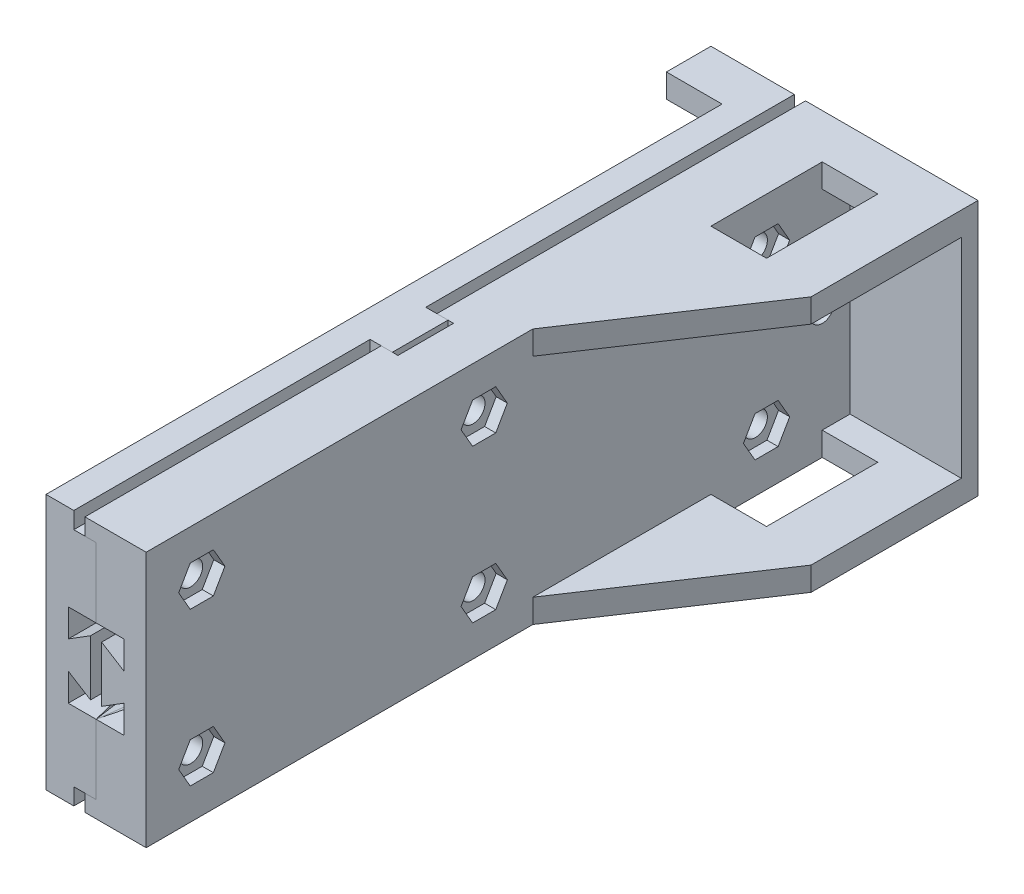
from build123d import *

# Parameters (mm, degrees)
SKETCH1_W                = 116.5
SKETCH1_H                = 15
BOSS_EXTRUDE1_DEPTH      = 1
SKETCH2_W                = 20
SKETCH2_H                = 15
BOSS_EXTRUDE2_DEPTH      = 4
CUT_EXTRUDE1_DEPTH       = 97.920070161
MIRROR2_COPY_1_SKETCH_W  = 20
MIRROR2_COPY_1_SKETCH_H  = 15
MIRROR2_COPY_1_DEPTH     = 4
MIRROR2_COPY_2_DEPTH     = 97.920070161
BOSS_EXTRUDE5_DEPTH      = 2.5
CUT_EXTRUDE2_DEPTH       = 60.942159621
SKETCH9_R                = 0.75
CUT_EXTRUDE3_DEPTH       = 118.0352511
CUT_EXTRUDE4_DEPTH       = 118.0352511
BOSS_EXTRUDE6_DEPTH      = 4
BOSS_EXTRUDE6_DEPTH_BACK = 14
SKETCH11_W               = 126.5
SKETCH11_H               = 40
BOSS_EXTRUDE7_START      = -11
BOSS_EXTRUDE7_DEPTH      = 11
BOSS_EXTRUDE8_DEPTH      = 5
SKETCH14_W               = 10
SKETCH14_H               = 3
BOSS_EXTRUDE9_DEPTH      = 4
SKETCH15_W               = 10
SKETCH15_H               = 3
CUT_EXTRUDE5_DEPTH       = 3
SKETCH16_R               = 2.15
CUT_EXTRUDE6_DEPTH       = 78.003652511
SKETCH18_R               = 1
CUT_EXTRUDE7_DEPTH       = 76.535173926
SKETCH19_R               = 3.5
SKETCH19_R_2             = 1
CUT_EXTRUDE8_DEPTH       = 2
SKETCH20_R               = 5.5
SKETCH20_R_2             = 3.5
BOSS_EXTRUDE10_DEPTH     = 2
BOSS_EXTRUDE11_DEPTH     = 20
CUT_EXTRUDE9_DEPTH       = 90.630142809
SKETCH24_W               = 20
SKETCH24_H               = 46
CUT_EXTRUDE10_DEPTH      = 10
CUT_EXTRUDE11_DEPTH      = 2
SKETCH26_W               = 8
SKETCH26_H               = 4.25
BOSS_EXTRUDE12_DEPTH     = 10


# Read off the part's stored shape, not the designer's step: Boss-Extrude7
with BuildPart() as part:
    # Sketch1 → Boss-Extrude1 (new, symmetric)
    with BuildSketch(Plane(origin=(0, 0, 0), x_dir=(0, 0, -1), z_dir=(1, 0, 0))):
        Rectangle(SKETCH1_W, SKETCH1_H)
    extrude(amount=BOSS_EXTRUDE1_DEPTH, both=True)

    # Sketch2 → Boss-Extrude2 (add)
    with BuildSketch(Plane(origin=(1, 0, 0), x_dir=(0, 0, -1), z_dir=(1, 0, 0))):
        with Locations((48.25, 0)):
            Rectangle(SKETCH2_W, SKETCH2_H)
    boss_extrude2 = extrude(amount=BOSS_EXTRUDE2_DEPTH)

    # Sketch3 → Cut-Extrude1 (cut, through all)
    with BuildSketch(Plane.XY.offset(-38.25)):
        Polygon((5, 2.5), (1, 5), (1, -5), (5, -2.5), align=None)
    cut_extrude1 = extrude(amount=-CUT_EXTRUDE1_DEPTH, mode=Mode.SUBTRACT)

    # Mirror1: Boss-Extrude2, Cut-Extrude1 across plane
    add(boss_extrude2.mirror(Plane(origin=(0, 0, 0), x_dir=(0, 0, 1), z_dir=(1, 0, 0))))
    add(cut_extrude1.mirror(Plane(origin=(0, 0, 0), x_dir=(0, 0, 1), z_dir=(1, 0, 0))), mode=Mode.SUBTRACT)

    # Mirror2: Boss-Extrude2, Cut-Extrude1 across plane
    add(boss_extrude2.mirror(Plane.XY))
    add(cut_extrude1.mirror(Plane.XY), mode=Mode.SUBTRACT)

    # Mirror2 copy 1 sketch → Mirror2 copy 1 (add)
    with BuildSketch(Plane.ZY.offset(1)):
        with Locations((48.25, 0)):
            Rectangle(MIRROR2_COPY_1_SKETCH_W, MIRROR2_COPY_1_SKETCH_H)
    extrude(amount=MIRROR2_COPY_1_DEPTH)

    # Mirror2 copy 2 sketch → Mirror2 copy 2 (cut, through all)
    with BuildSketch(Plane(origin=(0, 0, 38.25), x_dir=(-1, 0, 0), z_dir=(0, 0, -1))):
        Polygon((5, 2.5), (1, 5), (1, -5), (5, -2.5), align=None)
    extrude(amount=-MIRROR2_COPY_2_DEPTH, mode=Mode.SUBTRACT)

    # Sketch7 → Boss-Extrude5 (add)
    with BuildSketch(Plane(origin=(0, 7.5, 0), x_dir=(1, 0, 0), z_dir=(0, 1, 0))):
        Polygon((0, -58.25), (-5, -38.25), (-5, 38.25), (0, 58.25), (5, 38.25), (5, -38.25), align=None)
    boss_extrude5 = extrude(amount=BOSS_EXTRUDE5_DEPTH)

    # Sketch8 → Cut-Extrude2 (cut, through all)
    with BuildSketch(Plane.ZY.offset(5)):
        Polygon((-38.25, 10), (-58.25, 7.5), (-58.25, 10), align=None)
        Polygon((58.25, 10), (38.25, 10), (58.25, 7.5), align=None)
    cut_extrude2 = extrude(amount=-CUT_EXTRUDE2_DEPTH, mode=Mode.SUBTRACT)

    # Sketch9 → Cut-Extrude3 (cut, through all)
    with BuildSketch(Plane.XY.offset(58.25)):
        with Locations((1.2, 9.7)):
            Circle(SKETCH9_R)
        with Locations((-1.2, 9.7)):
            Circle(SKETCH9_R)
    cut_extrude3 = extrude(amount=-CUT_EXTRUDE3_DEPTH, mode=Mode.SUBTRACT)

    # Mirror4: Boss-Extrude5, Cut-Extrude2, Cut-Extrude3 across plane
    add(boss_extrude5.mirror(Plane.ZX))
    add(cut_extrude2.mirror(Plane.ZX), mode=Mode.SUBTRACT)
    add(cut_extrude3.mirror(Plane.ZX), mode=Mode.SUBTRACT)

    # Sketch10 → Cut-Extrude4 (cut, through all)
    with BuildSketch(Plane(origin=(0, 0, -58.25), x_dir=(-1, 0, 0), z_dir=(0, 0, -1))):
        Polygon((-5, 8.5), (-3.2, 10), (-5, 10), align=None)
        Polygon((5, 10), (5, 8.5), (3.2, 10), align=None)
        Polygon((-5, -10), (-5, -8.5), (-3.2, -10), align=None)
        Polygon((5, -8.5), (3.2, -10), (5, -10), align=None)
    extrude(amount=-CUT_EXTRUDE4_DEPTH, mode=Mode.SUBTRACT)


with BuildPart() as body_2:
    # Sketch11 → Boss-Extrude6 (new, two sides: drawn at the far end of the back side and taken through both)
    with BuildSketch(Plane.ZY.offset(5).offset(-BOSS_EXTRUDE6_DEPTH_BACK)):
        with Locations((-5, 0)):
            Rectangle(SKETCH11_W, SKETCH11_H)
    extrude(amount=BOSS_EXTRUDE6_DEPTH + BOSS_EXTRUDE6_DEPTH_BACK)

    # Combine1: cut part
    add(part.part, mode=Mode.SUBTRACT)


with BuildPart() as body_2_2:
    # Split1: the piece on the far side of the plane
    add(body_2.part)
    split(bisect_by=Plane(origin=(0, 0, 0), x_dir=(0, 0, 1), z_dir=(1, 0, 0)), keep=Keep.BOTTOM)

    # Sketch13 → Boss-Extrude8 (add)
    with BuildSketch(Plane.ZY.offset(9)):
        Polygon((58.25, 23), (-71.25, 23), (-71.25, -23), (58.25, -23), (58.25, -20), (-68.25, -20), (-68.25, 20), (58.25, 20), align=None)
    extrude(amount=-BOSS_EXTRUDE8_DEPTH)

    # Sketch14 → Boss-Extrude9 (add)
    with BuildSketch(Plane(origin=(-4, 0, 0), x_dir=(0, 0, -1), z_dir=(1, 0, 0))):
        with Locations((0, 21.5)):
            Rectangle(SKETCH14_W, SKETCH14_H)
        with Locations((0, -21.5)):
            Rectangle(SKETCH14_W, SKETCH14_H)
    extrude(amount=BOSS_EXTRUDE9_DEPTH)


with BuildPart() as body_2_1:
    add(body_2.part)

    # Split1
    split(bisect_by=Plane(origin=(0, 0, 0), x_dir=(0, 0, 1), z_dir=(1, 0, 0)), keep=Keep.TOP)

    # Boss-Extrude7 outline → Boss-Extrude7 (add)
    with BuildSketch(Plane(origin=(9, 0, 0), x_dir=(0, 0, -1), z_dir=(1, 0, 0)).offset(BOSS_EXTRUDE7_START)):
        Polygon((71.25, -23), (71.25, 23), (-58.25, 23), (-58.25, 20), (68.25, 20), (68.25, -20), (-58.25, -20), (-58.25, -23), align=None)
    extrude(amount=BOSS_EXTRUDE7_DEPTH)

    # Sketch15 → Cut-Extrude5 (cut)
    with BuildSketch(Plane.ZY.offset(2)):
        with Locations((0, -21.5)):
            Rectangle(SKETCH15_W, SKETCH15_H)
        with Locations((0, 21.5)):
            Rectangle(SKETCH15_W, SKETCH15_H)
    extrude(amount=-CUT_EXTRUDE5_DEPTH, mode=Mode.SUBTRACT)


with BuildPart() as cut_extrude6_tool:
    # Sketch16 → Cut-Extrude6 (new, through all)
    with BuildSketch(Plane.ZY.offset(9)):
        with Locations((-63.25, 0)):
            Circle(SKETCH16_R)
        with Locations((48.25, -13.75)):
            Circle(SKETCH16_R)
        with Locations((-53.25, -13.75)):
            Circle(SKETCH16_R)
        with Locations((-2.5, -13.75)):
            Circle(SKETCH16_R)
        with Locations(Location((-53.25, 13.75, 0), (0, 0, 180))):
            Circle(SKETCH16_R)
        with Locations(Location((-2.5, 13.75, 0), (0, 0, 180))):
            Circle(SKETCH16_R)
        with Locations(Location((48.25, 13.75, 0), (0, 0, 180))):
            Circle(SKETCH16_R)
    extrude(amount=-CUT_EXTRUDE6_DEPTH)


with BuildPart() as body_2_3:
    add(body_2_1.part)

    # Cut-Extrude6: cut by cut_extrude6_tool
    add(cut_extrude6_tool.part, mode=Mode.SUBTRACT)

    # Sketch22 → Boss-Extrude11 (add)
    with BuildSketch(Plane(origin=(9, 0, 0), x_dir=(0, 0, -1), z_dir=(1, 0, 0))):
        Polygon((11.25, -23), (11.25, -18.75), (68.25, -18.75), (68.25, 18.75), (11.25, 18.75), (11.25, 23), (71.25, 23), (71.25, -23), align=None)
    extrude(amount=BOSS_EXTRUDE11_DEPTH)

    # Sketch23 → Cut-Extrude9 (cut, through all)
    with BuildSketch(Plane.XZ.offset(23)):
        Polygon((29, -11.25), (9, -11.25), (29, -41.25), align=None)
    extrude(amount=-CUT_EXTRUDE9_DEPTH, mode=Mode.SUBTRACT)

    # Sketch24 → Cut-Extrude10 (cut)
    with BuildSketch(Plane(origin=(9, 0, 0), x_dir=(0, 0, -1), z_dir=(1, 0, 0))):
        with Locations((53.25, 0)):
            Rectangle(SKETCH24_W, SKETCH24_H)
    extrude(amount=CUT_EXTRUDE10_DEPTH, mode=Mode.SUBTRACT)

    # Sketch25 → Cut-Extrude11 (cut)
    with BuildSketch(Plane(origin=(9, 0, 0), x_dir=(0, 0, -1), z_dir=(1, 0, 0))):
        Polygon((55.328460969, -10.15), (51.171539031, -10.15), (49.093078062, -13.75), (51.171539031, -17.35), (55.328460969, -17.35), (57.406921938, -13.75), align=None)
        Polygon((4.578460969, -10.15), (0.421539031, -10.15), (-1.656921938, -13.75), (0.421539031, -17.35), (4.578460969, -17.35), (6.656921938, -13.75), align=None)
        Polygon((-46.171539031, -10.15), (-50.328460969, -10.15), (-52.406921938, -13.75), (-50.328460969, -17.35), (-46.171539031, -17.35), (-44.093078062, -13.75), align=None)
        Polygon((4.578460969, 17.35), (0.421539031, 17.35), (-1.656921938, 13.75), (0.421539031, 10.15), (4.578460969, 10.15), (6.656921938, 13.75), align=None)
        Polygon((-46.171539031, 17.35), (-50.328460969, 17.35), (-52.406921938, 13.75), (-50.328460969, 10.15), (-46.171539031, 10.15), (-44.093078062, 13.75), align=None)
        Polygon((55.328460969, 17.35), (51.171539031, 17.35), (49.093078062, 13.75), (51.171539031, 10.15), (55.328460969, 10.15), (57.406921938, 13.75), align=None)
    extrude(amount=-CUT_EXTRUDE11_DEPTH, mode=Mode.SUBTRACT)


with BuildPart() as body_2_2_1:
    add(body_2_2.part)

    # Cut-Extrude6: cut by cut_extrude6_tool
    add(cut_extrude6_tool.part, mode=Mode.SUBTRACT)

    # Sketch18 → Cut-Extrude7 (cut, through all)
    with BuildSketch(Plane(origin=(-1, 0, 0), x_dir=(0, 0, -1), z_dir=(1, 0, 0))):
        with Locations((53.25, 0)):
            Circle(SKETCH18_R)
    extrude(amount=-CUT_EXTRUDE7_DEPTH, mode=Mode.SUBTRACT)

    # Sketch19 → Cut-Extrude8 (cut)
    with BuildSketch(Plane.ZY.offset(9)):
        with Locations((-53.25, 0)):
            Circle(SKETCH19_R)
        with Locations(Location((-53.25, 0, 0), (0, 0, 180))):
            Circle(SKETCH19_R_2, mode=Mode.SUBTRACT)
    extrude(amount=-CUT_EXTRUDE8_DEPTH, mode=Mode.SUBTRACT)

    # Sketch20 → Boss-Extrude10 (add)
    with BuildSketch(Plane.ZY.offset(9)):
        with Locations((-53.25, 0)):
            Circle(SKETCH20_R)
        with Locations((-53.25, 0)):
            Circle(SKETCH20_R_2, mode=Mode.SUBTRACT)
    extrude(amount=BOSS_EXTRUDE10_DEPTH)

    # Sketch26 → Boss-Extrude12 (add)
    with BuildSketch(Plane.ZY.offset(9)):
        with Locations((-67.25, 20.875)):
            Rectangle(SKETCH26_W, SKETCH26_H)
        with Locations((-67.25, -20.875)):
            Rectangle(SKETCH26_W, SKETCH26_H)
    extrude(amount=BOSS_EXTRUDE12_DEPTH)


solid = Compound([body_2_3.part, body_2_2_1.part])
